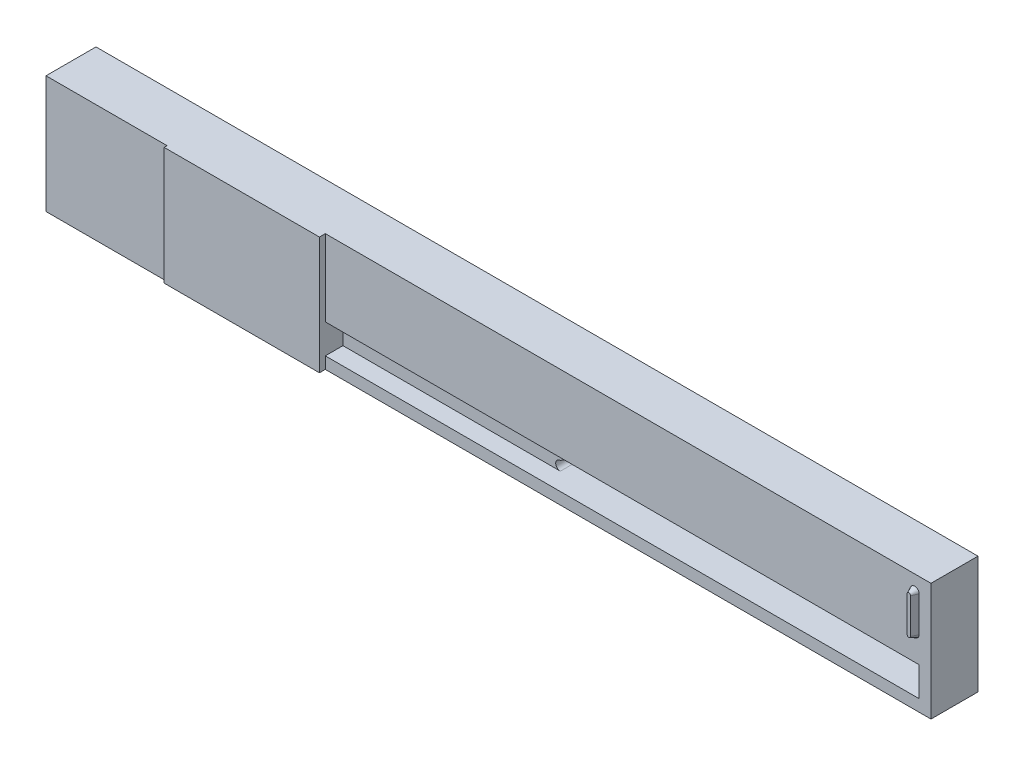
from build123d import *

# Parameters (mm, degrees)
SKETCH1_W               = 130
SKETCH1_H               = 20
BOSS_EXTRUDE1_DEPTH     = 8
SKETCH2_W               = 3
SKETCH2_H               = 13.5
CUT_EXTRUDE1_DEPTH      = 7
SKETCH3_W               = 27
SKETCH3_H               = 20
BOSS_EXTRUDE2_DEPTH     = 1
CUT_EXTRUDE3_DEPTH      = 2
CUT_EXTRUDE4_DEPTH      = 7
SKETCH7_R               = 3.15
CUT_EXTRUDE5_DEPTH      = 3
BOSS_EXTRUDE3_DEPTH     = 1.5
CIRPATTERN1_COUNT       = 8
SKETCH9_R               = 1
CUT_EXTRUDE6_DEPTH      = 1
CUT_EXTRUDE6_DRAFT      = -25
SKETCH10_R              = 0.5
CUT_EXTRUDE7_DEPTH      = 3
SKETCH11_W              = 101
SKETCH11_H              = 5
CUT_EXTRUDE8_DEPTH      = 3
BOSS_EXTRUDE5_DEPTH     = 5
LPATTERN2_COUNT         = 5
LPATTERN2_PITCH         = 1
BOSS_EXTRUDE6_DEPTH     = 5
LPATTERN3_COUNT         = 3
LPATTERN3_PITCH         = 1
BOSS_EXTRUDE7_DEPTH     = 1
BOSS_EXTRUDE7_TAPER     = 25
SKETCH18_W              = 0.569871795
SKETCH18_H              = 4.640384615
SKETCH18_H_2            = 6.512820512
CUT_EXTRUDE10_DEPTH     = 1
SKETCH19_W              = 9
SKETCH19_H              = 20
BOSS_EXTRUDE8_DEPTH     = 20
CUT_EXTRUDE11_START     = -0.5
CUT_EXTRUDE11_OUTLINE_W = 20.583981275
CUT_EXTRUDE11_OUTLINE_H = 20
CUT_EXTRUDE11_DEPTH     = 0.5


# Read off the part's stored shape, not the designer's step: Cut-Extrude11
with BuildPart() as part:
    # Sketch1 → Boss-Extrude1 (new body)
    with BuildSketch(Plane.XY):
        Rectangle(SKETCH1_W, SKETCH1_H)
    extrude(amount=BOSS_EXTRUDE1_DEPTH)

    # Sketch2 → Cut-Extrude1 (cut)
    with BuildSketch(Plane.ZY.offset(65)):
        with Locations((3.1, 0.45)):
            Rectangle(SKETCH2_W, SKETCH2_H)
    extrude(amount=-CUT_EXTRUDE1_DEPTH, mode=Mode.SUBTRACT)

    # Sketch3 → Boss-Extrude2 (add)
    with BuildSketch(Plane.XY.offset(8)):
        with Locations((-51.5, 0)):
            Rectangle(SKETCH3_W, SKETCH3_H)
    extrude(amount=BOSS_EXTRUDE2_DEPTH)

    # Sketch4 → Cut-Extrude3 (cut)
    with BuildSketch(Plane(origin=(0, 0, 0), x_dir=(-1, 0, 0), z_dir=(0, 0, -1))):
        Polygon((-4, -9), (7, -9), (-4, -2), (-64, -2), (-64, -9), align=None)
    extrude(amount=-CUT_EXTRUDE3_DEPTH, mode=Mode.SUBTRACT)

    # Sketch6 → Cut-Extrude4 (cut)
    with BuildSketch(Plane(origin=(0, 0, 2), x_dir=(-1, 0, 0), z_dir=(0, 0, -1))):
        with BuildLine():
            Line((-63, -3), (-4, -3))
            Line((-4, -3), (1.029142106, -6.427272248))
            ThreePointArc((1.029142106, -6.427272248), (1.815505982, -7.213636124), (1.029142106, -8))
            Line((1.029142106, -8), (-4, -8))
            Line((-4, -8), (-63, -8))
            Line((-63, -8), (-63, -3))
        make_face()
    extrude(amount=-CUT_EXTRUDE4_DEPTH, mode=Mode.SUBTRACT)

    # Sketch7 → Cut-Extrude5 (cut)
    with BuildSketch(Plane(origin=(0, 0, 0), x_dir=(-1, 0, 0), z_dir=(0, 0, -1))):
        with Locations((-46, 4)):
            Circle(SKETCH7_R)
    extrude(amount=-CUT_EXTRUDE5_DEPTH, mode=Mode.SUBTRACT)

    # Sketch8 → Boss-Extrude3 (add)
    with BuildSketch(Plane(origin=(0, 0, 3), x_dir=(-1, 0, 0), z_dir=(0, 0, -1))):
        with BuildLine():
            Line((-46, 4), (-46, 6))
            ThreePointArc((-46, 6), (-45, 6.414213562), (-44.585786438, 5.414213562))
            Line((-44.585786438, 5.414213562), (-46, 4))
        make_face()
    boss_extrude3 = extrude(amount=BOSS_EXTRUDE3_DEPTH)

    # CirPattern1: Boss-Extrude3 ×8 about axis
    cirpattern1_axis = Axis((46, 4, 0), (0, 0, 1))
    for i in range(1, CIRPATTERN1_COUNT):
        add(boss_extrude3.rotate(cirpattern1_axis, i * 360 / CIRPATTERN1_COUNT))


with BuildPart() as cut_extrude6_tool:
    # Sketch9 → Cut-Extrude6 (with draft: the straight prism first)
    with BuildSketch(Plane(origin=(0, 0, 1.5), x_dir=(-1, 0, 0), z_dir=(0, 0, -1))):
        with Locations((-46, 4)):
            Circle(SKETCH9_R)
    extrude(amount=-CUT_EXTRUDE6_DEPTH)
    # Cut-Extrude6: the draft: its side faces are tilted about the plane it starts from
    cut_extrude6_sides = [cut_extrude6_tool.faces().sort_by_distance(p)[0] for p in [
        (47, 4, 2),
    ]]
    draft(cut_extrude6_sides, Plane(origin=(0, 0, 1.5), x_dir=(-1, 0, 0), z_dir=(0, 0, -1)), CUT_EXTRUDE6_DRAFT)


with BuildPart() as part_1:
    add(part.part)

    # Cut-Extrude6: cut by cut_extrude6_tool
    add(cut_extrude6_tool.part, mode=Mode.SUBTRACT)

    # Sketch10 → Cut-Extrude7 (cut)
    with BuildSketch(Plane(origin=(0, 0, 0), x_dir=(-1, 0, 0), z_dir=(0, 0, -1))):
        with Locations((-54.346544303, 4)):
            Circle(SKETCH10_R)
    extrude(amount=-CUT_EXTRUDE7_DEPTH, mode=Mode.SUBTRACT)

    # Sketch11 → Cut-Extrude8 (cut)
    with BuildSketch(Plane.XY.offset(8)):
        with Locations((12.5, -5.5)):
            Rectangle(SKETCH11_W, SKETCH11_H)
    extrude(amount=-CUT_EXTRUDE8_DEPTH, mode=Mode.SUBTRACT)

    # Sketch13 → Boss-Extrude5 (add)
    with BuildSketch(Plane.ZY.offset(58)):
        with BuildLine():
            Line((2.394077923, -5.196267403), (2.394077923, -4.196267403))
            Line((2.394077923, -4.196267403), (3.296543728, -4.196267403))
            ThreePointArc((3.296543728, -4.196267403), (3.796543728, -4.696267403), (3.296543728, -5.196267403))
            Line((3.296543728, -5.196267403), (2.394077923, -5.196267403))
        make_face()
    boss_extrude5 = extrude(amount=BOSS_EXTRUDE5_DEPTH)

    # LPattern2: Boss-Extrude5 ×5
    with Locations(*[(0, i * LPATTERN2_PITCH, 0) for i in range(1, LPATTERN2_COUNT)]):
        add(boss_extrude5)

    # Sketch15 → Boss-Extrude6 (add)
    with BuildSketch(Plane.ZY.offset(58)):
        with BuildLine():
            Line((2.394077923, 2.550445293), (2.394077923, 3.550445293))
            Line((2.394077923, 3.550445293), (3.394077923, 3.550445293))
            ThreePointArc((3.394077923, 3.550445293), (3.894077923, 3.050445293), (3.394077923, 2.550445293))
            Line((3.394077923, 2.550445293), (2.394077923, 2.550445293))
        make_face()
    boss_extrude6 = extrude(amount=BOSS_EXTRUDE6_DEPTH)

    # LPattern3: Boss-Extrude6 ×3
    with Locations(*[(0, i * LPATTERN3_PITCH, 0) for i in range(1, LPATTERN3_COUNT)]):
        add(boss_extrude6)

    # Sketch16 → Boss-Extrude7 (add)
    with BuildSketch(Plane.XY.offset(8)):
        with BuildLine():
            Line((63, 1.437655511), (63, 7.437655511))
            ThreePointArc((63, 7.437655511), (62.243555183, 8.194100328), (61.487110367, 7.437655511))
            Line((61.487110367, 7.437655511), (61.487110367, 1.437655511))
            ThreePointArc((61.487110367, 1.437655511), (62.243555183, 0.681210694), (63, 1.437655511))
        make_face()
    extrude(amount=BOSS_EXTRUDE7_DEPTH, taper=BOSS_EXTRUDE7_TAPER)

    # Sketch18 → Cut-Extrude10 (cut)
    # profile 1 of 6: a face of its own
    with BuildSketch(Plane(origin=(0, 0, 0), x_dir=(-1, 0, 0), z_dir=(0, 0, -1))):
        with BuildLine():
            add(Edge.make_bspline(
                [(33.830181075, 3.951769435), (33.865543891, 3.950129044), (33.934791076, 3.946916844), (34.034927433, 3.919409593), (34.126108012, 3.87278302), (34.206984756, 3.810227028), (34.276384608, 3.736658752), (34.324972468, 3.650913852), (34.356200672, 3.558278893), (34.359971766, 3.493662946), (34.361891812, 3.460763826)],
                knots=[0, 0, 0, 0, 1.055194115, 2.066272739, 3.074728998, 4.095836921, 5.109056067, 6.073838105, 7.019297344, 8, 8, 8, 8], degree=3))
            add(Edge.make_bspline(
                [(34.361891812, 3.460763826), (34.359928465, 3.428718727), (34.35604716, 3.365369358), (34.324996589, 3.274340344), (34.275970529, 3.189786858), (34.207029258, 3.116361427), (34.12609622, 3.053840016), (34.034930566, 3.007204276), (33.934790252, 2.979699455), (33.865543612, 2.97648692), (33.830181075, 2.974846358)],
                knots=[0, 0, 0, 0, 0.96129708, 1.900370562, 2.859976407, 3.87933698, 4.906634145, 5.921202961, 6.938410037, 8, 8, 8, 8], degree=3))
            add(Edge.make_bspline(
                [(33.830181075, 2.974846358), (33.795222919, 2.976424279), (33.727181435, 2.979495496), (33.628544449, 3.007743957), (33.538141333, 3.053855975), (33.457106855, 3.115952054), (33.389560648, 3.190237796), (33.340396543, 3.274288743), (33.309417684, 3.365382495), (33.305526715, 3.42872314), (33.303558479, 3.460763826)],
                knots=[0, 0, 0, 0, 1.054934014, 2.053291228, 3.073705704, 4.106921865, 5.123545215, 6.088680038, 7.033164197, 8, 8, 8, 8], degree=3))
            add(Edge.make_bspline(
                [(33.303558479, 3.460763826), (33.305483593, 3.493658367), (33.309264639, 3.558265322), (33.340419764, 3.65096631), (33.38915113, 3.736204178), (33.457151581, 3.810636156), (33.53812943, 3.872767159), (33.628547525, 3.918869939), (33.727180622, 3.947120798), (33.795222643, 3.950191684), (33.830181075, 3.951769435)],
                knots=[0, 0, 0, 0, 0.98631895, 1.937192651, 2.907499808, 3.917963147, 4.944918757, 5.95915025, 6.951458133, 8, 8, 8, 8], degree=3))
        make_face()
    # profile 2 of 6: a face of its own
    with BuildSketch(Plane(origin=(0, 0, 0), x_dir=(-1, 0, 0), z_dir=(0, 0, -1))):
        with Locations((33.832725146, -0.322269026)):
            Rectangle(SKETCH18_W, SKETCH18_H)
    # profile 3 of 6: a face of its own
    with BuildSketch(Plane(origin=(0, 0, 0), x_dir=(-1, 0, 0), z_dir=(0, 0, -1))):
        with BuildLine():
            Line((35.501635402, 1.997923281), (36.071507197, 1.997923281))
            Line((36.071507197, 1.997923281), (36.071507197, 1.160924082))
            add(Edge.make_bspline(
                [(36.071507197, 1.160924082), (36.132354049, 1.236838737), (36.250429489, 1.384153772), (36.447069637, 1.577775386), (36.654884999, 1.737333151), (36.872602919, 1.864521463), (37.100518952, 1.960400342), (37.337243813, 2.029644245), (37.58419478, 2.071163863), (37.752133115, 2.076588995), (37.837092133, 2.079333537)],
                knots=[0, 0, 0, 0, 1.12780773, 2.188550248, 3.19190651, 4.159438251, 5.104880172, 6.052711206, 7.014878035, 8, 8, 8, 8], degree=3))
            add(Edge.make_bspline(
                [(37.837092133, 2.079333537), (37.922963426, 2.076167254), (38.091034261, 2.069970074), (38.335741601, 2.020954078), (38.564293329, 1.9372334), (38.775874523, 1.822548644), (38.966605325, 1.679934042), (39.134108984, 1.513785781), (39.272653732, 1.32267603), (39.365540377, 1.145378304), (39.426728338, 0.988100063), (39.465249864, 0.853395245), (39.497963216, 0.703320885), (39.526323673, 0.538330488), (39.545513576, 0.357268057), (39.560648877, 0.160875815), (39.571495936, -0.050782621), (39.571926298, -0.197171217), (39.572148223, -0.272659652)],
                knots=[0, 0, 0, 0, 1.235846778, 2.418850247, 3.575807741, 4.728682307, 5.871620074, 6.994088408, 8.11269785, 9.256955736, 9.865816715, 10.540099792, 11.271859618, 12.076849838, 12.949306005, 13.892391288, 14.913166135, 16, 16, 16, 16], degree=3))
            Line((39.572148223, -0.272659652), (39.572148223, -2.642461334))
            Line((39.572148223, -2.642461334), (39.002276428, -2.642461334))
            Line((39.002276428, -2.642461334), (39.002276428, -0.459648834))
            add(Edge.make_bspline(
                [(39.002276428, -0.459648834), (39.001925893, -0.39647097), (39.00125538, -0.275622468), (38.999140564, -0.102595811), (38.994042772, 0.054315552), (38.986879404, 0.19473649), (38.976394592, 0.318532165), (38.965467818, 0.42595471), (38.952105646, 0.516867737), (38.940198646, 0.571595815), (38.934858559, 0.596140428)],
                knots=[0, 0, 0, 0, 1.430800155, 2.736877192, 3.918605307, 4.986035426, 5.920637409, 6.731861385, 7.431261377, 8, 8, 8, 8], degree=3))
            add(Edge.make_bspline(
                [(38.934858559, 0.596140428), (38.915580809, 0.668187864), (38.878477105, 0.806856886), (38.786794021, 0.994951783), (38.671016865, 1.154968495), (38.529687909, 1.28591769), (38.364172301, 1.387827637), (38.174929342, 1.458537526), (37.963785236, 1.502763043), (37.815277999, 1.507166554), (37.737873383, 1.509461743)],
                knots=[0, 0, 0, 0, 1.084156227, 2.086665306, 3.027808233, 3.945421172, 4.874247719, 5.839848303, 6.874090471, 8, 8, 8, 8], degree=3))
            add(Edge.make_bspline(
                [(37.737873383, 1.509461743), (37.692030586, 1.508598134), (37.601308874, 1.506889075), (37.466779639, 1.48974172), (37.336288639, 1.461695665), (37.20852626, 1.423833994), (37.086047834, 1.371832449), (36.964918335, 1.312814877), (36.84969892, 1.239248835), (36.737932756, 1.157260136), (36.633950948, 1.066402146), (36.537198106, 0.970527106), (36.450950555, 0.868427082), (36.372811672, 0.761747177), (36.30535968, 0.649022271), (36.246480506, 0.531339887), (36.196522888, 0.408545131), (36.171698575, 0.323318948), (36.15927763, 0.280675685)],
                knots=[0, 0, 0, 0, 1.023777757, 2.026029729, 3.023749952, 4.003683103, 4.997618607, 5.993177895, 7.010360494, 8.046726602, 9.087585522, 10.09234134, 11.086953743, 12.070360549, 13.043493632, 14.017870808, 15.008233677, 16, 16, 16, 16], degree=3))
            add(Edge.make_bspline(
                [(36.15927763, 0.280675685), (36.152129982, 0.249369816), (36.136569926, 0.181218579), (36.119763871, 0.069377989), (36.104510127, -0.05999868), (36.091743073, -0.206760455), (36.083931818, -0.371421171), (36.075414841, -0.55327762), (36.072314116, -0.753054949), (36.071783702, -0.892141163), (36.071507197, -0.964646831)],
                knots=[0, 0, 0, 0, 0.615963638, 1.340920617, 2.168419149, 3.115676021, 4.16674242, 5.331190069, 6.6087489, 8, 8, 8, 8], degree=3))
            Line((36.071507197, -0.964646831), (36.071507197, -2.642461334))
            Line((36.071507197, -2.642461334), (35.501635402, -2.642461334))
            Line((35.501635402, -2.642461334), (35.501635402, 1.997923281))
        make_face()
    # profile 4 of 6: a face of its own
    with BuildSketch(Plane(origin=(0, 0, 0), x_dir=(-1, 0, 0), z_dir=(0, 0, -1))):
        Polygon((41.44458412, 3.870359178), (42.014455915, 3.870359178), (42.014455915, 1.997923281), (42.828558479, 1.997923281), (42.828558479, 1.428051486), (42.014455915, 1.428051486), (42.014455915, -2.642461334), (41.44458412, -2.642461334), (41.44458412, 1.428051486), (40.630481556, 1.428051486), (40.630481556, 1.997923281), (41.44458412, 1.997923281), align=None)
    # profile 5 of 6: a face of its own
    with BuildSketch(Plane(origin=(0, 0, 0), x_dir=(-1, 0, 0), z_dir=(0, 0, -1))):
        with BuildLine():
            Line((47.613955114, -1.177076719), (48.120225146, -1.442932088))
            add(Edge.make_bspline(
                [(48.120225146, -1.442932088), (48.079881609, -1.51449356), (48.001389062, -1.653723847), (47.866404848, -1.845007365), (47.724904945, -2.017088221), (47.570502031, -2.165369165), (47.407815614, -2.294639535), (47.235943512, -2.40773816), (47.053990942, -2.504110332), (46.861949299, -2.585304204), (46.658205827, -2.647732858), (46.44226679, -2.691827659), (46.213718506, -2.71908416), (46.057061865, -2.722250344), (45.976845739, -2.723871591)],
                knots=[0, 0, 0, 0, 1.120438281, 2.179929193, 3.190490725, 4.156257408, 5.095198341, 6.022838206, 6.959905092, 7.901321166, 8.864066838, 9.862729781, 10.905609505, 12, 12, 12, 12], degree=3))
            add(Edge.make_bspline(
                [(45.976845739, -2.723871591), (45.887688151, -2.721790287), (45.713767526, -2.717730266), (45.460602556, -2.682728224), (45.222242754, -2.625628373), (44.998701521, -2.545862319), (44.790526292, -2.441672745), (44.597303312, -2.314746257), (44.418016458, -2.165734881), (44.258315393, -1.993347904), (44.114544348, -1.808867782), (43.987678932, -1.616633534), (43.88162045, -1.417128827), (43.795346429, -1.211623733), (43.725669031, -1.001413527), (43.677106583, -0.784585578), (43.649112611, -0.561726733), (43.644822832, -0.410964424), (43.642661043, -0.334989379)],
                knots=[0, 0, 0, 0, 1.145258523, 2.234067595, 3.276747158, 4.290159414, 5.277019952, 6.260822364, 7.254936242, 8.264827045, 9.274100331, 10.257902744, 11.220704747, 12.172965371, 13.118907548, 14.062713208, 15.023725156, 16, 16, 16, 16], degree=3))
            add(Edge.make_bspline(
                [(43.642661043, -0.334989379), (43.644582628, -0.26369733), (43.648390956, -0.122405902), (43.672395384, 0.086718728), (43.714937288, 0.289970349), (43.773314332, 0.487517848), (43.848700165, 0.679030462), (43.940924334, 0.864624749), (44.050130505, 1.044103217), (44.134445213, 1.157320331), (44.176915851, 1.214349563)],
                knots=[0, 0, 0, 0, 1.024358464, 2.0301432, 3.019427413, 4.004406732, 4.986367066, 5.972626655, 6.978780325, 8, 8, 8, 8], degree=3))
            add(Edge.make_bspline(
                [(44.176915851, 1.214349563), (44.234442647, 1.283054513), (44.347673936, 1.418288015), (44.539183323, 1.59597612), (44.746556537, 1.744826969), (44.967194772, 1.868211345), (45.203662375, 1.961962104), (45.452780661, 2.031825861), (45.717386224, 2.070974538), (45.898279982, 2.076504179), (45.990838127, 2.079333537)],
                knots=[0, 0, 0, 0, 1.030682036, 2.02871468, 2.997146059, 3.962720338, 4.930598197, 5.918074684, 6.934738563, 8, 8, 8, 8], degree=3))
            add(Edge.make_bspline(
                [(45.990838127, 2.079333537), (46.085993068, 2.076876906), (46.272665371, 2.072057555), (46.544866505, 2.02737835), (46.802423805, 1.956525858), (47.045234205, 1.856461124), (47.273322324, 1.727357366), (47.485205586, 1.567442882), (47.684507616, 1.381627209), (47.800456037, 1.238728243), (47.859457918, 1.166012223)],
                knots=[0, 0, 0, 0, 1.056321875, 2.072262726, 3.055038591, 4.01806755, 4.982017516, 5.957941055, 6.960871419, 8, 8, 8, 8], degree=3))
            add(Edge.make_bspline(
                [(47.859457918, 1.166012223), (47.899602506, 1.111214297), (47.979624468, 1.001983196), (48.079858492, 0.823872668), (48.166866909, 0.637526304), (48.236413853, 0.439931908), (48.292728376, 0.23343067), (48.333471462, 0.016546339), (48.357364912, -0.210656501), (48.362061549, -0.365463251), (48.364455915, -0.444384411)],
                knots=[0, 0, 0, 0, 0.94817472, 1.890038105, 2.849395472, 3.817997239, 4.812318967, 5.836947057, 6.897266129, 8, 8, 8, 8], degree=3))
            Line((48.364455915, -0.444384411), (44.212532838, -0.444384411))
            add(Edge.make_bspline(
                [(44.212532838, -0.444384411), (44.215326124, -0.505526682), (44.220819008, -0.625760492), (44.246427911, -0.801693198), (44.286793543, -0.969284833), (44.343524557, -1.127278352), (44.412225833, -1.277737298), (44.496382777, -1.419545565), (44.596784539, -1.552057238), (44.708772593, -1.676457616), (44.833426895, -1.787239283), (44.964568451, -1.88639322), (45.104075347, -1.96949766), (45.250847584, -2.036952603), (45.404647823, -2.089759776), (45.56552452, -2.125805679), (45.733161102, -2.149948573), (45.84743522, -2.152633109), (45.905611764, -2.153999796)],
                knots=[0, 0, 0, 0, 1.094153842, 2.151609401, 3.174256925, 4.172055639, 5.149267565, 6.128595816, 7.11444997, 8.118368179, 9.117203808, 10.09244225, 11.054858984, 12.015122123, 12.976791628, 13.957293641, 14.960065497, 16, 16, 16, 16], degree=3))
            add(Edge.make_bspline(
                [(45.905611764, -2.153999796), (45.962491704, -2.152896607), (46.075352414, -2.15070767), (46.243429398, -2.129422631), (46.408782541, -2.095005131), (46.570727468, -2.048033292), (46.725977431, -1.990743861), (46.8697515, -1.92161439), (47.001977034, -1.845142707), (47.125560674, -1.757676582), (47.245432333, -1.650618871), (47.36434513, -1.517022635), (47.491847058, -1.359020977), (47.571656748, -1.240102412), (47.613955114, -1.177076719)],
                knots=[0, 0, 0, 0, 0.99110716, 1.966546729, 2.947904876, 3.932708344, 4.903319531, 5.828989031, 6.710028674, 7.56322171, 8.463672341, 9.504779593, 10.677557249, 12, 12, 12, 12], degree=3))
        make_face()
        with BuildLine():
            add(Edge.make_bspline(
                [(47.79458412, 0.125487384), (47.773725958, 0.20107574), (47.733580711, 0.346558995), (47.649694736, 0.548018896), (47.555222084, 0.727066945), (47.443422657, 0.882332851), (47.31675154, 1.020224938), (47.170438137, 1.140727229), (47.006361588, 1.248527461), (46.825370004, 1.339518425), (46.633705622, 1.416970025), (46.433034388, 1.468904164), (46.228278116, 1.504481476), (46.089785911, 1.507794559), (46.020094937, 1.509461743)],
                knots=[0, 0, 0, 0, 1.154881502, 2.222775134, 3.210006277, 4.132804581, 5.035138423, 5.962687519, 6.919655026, 7.923214229, 8.944639381, 9.960483929, 10.97369054, 12, 12, 12, 12], degree=3))
            add(Edge.make_bspline(
                [(46.020094937, 1.509461743), (45.963218099, 1.508351996), (45.850784547, 1.506158259), (45.685138323, 1.485348167), (45.526062298, 1.450949592), (45.372382705, 1.403841742), (45.226113415, 1.341051849), (45.084245764, 1.26742228), (44.950387045, 1.177539693), (44.866673552, 1.109034342), (44.824381796, 1.074425685)],
                knots=[0, 0, 0, 0, 1.04873581, 2.073130211, 3.073294108, 4.04793562, 5.032784715, 6.005352987, 6.992311501, 8, 8, 8, 8], degree=3))
            add(Edge.make_bspline(
                [(44.824381796, 1.074425685), (44.794095413, 1.047040284), (44.732803156, 0.991618906), (44.650905352, 0.896134488), (44.572491066, 0.79317094), (44.501128582, 0.678789071), (44.435673532, 0.554291372), (44.374423288, 0.420727948), (44.319293654, 0.277085269), (44.288276426, 0.1769867), (44.272318495, 0.125487384)],
                knots=[0, 0, 0, 0, 0.879870761, 1.780643979, 2.707998968, 3.669668524, 4.684282772, 5.740141944, 6.837334558, 8, 8, 8, 8], degree=3))
            Line((44.272318495, 0.125487384), (47.79458412, 0.125487384))
        make_face(mode=Mode.SUBTRACT)
    # profile 6 of 6: a face of its own
    with BuildSketch(Plane(origin=(0, 0, 0), x_dir=(-1, 0, 0), z_dir=(0, 0, -1))):
        with Locations((49.707725146, 0.613948922)):
            Rectangle(SKETCH18_W, SKETCH18_H_2)
    extrude(amount=-CUT_EXTRUDE10_DEPTH, mode=Mode.SUBTRACT)

    # Sketch19 → Boss-Extrude8 (add)
    with BuildSketch(Plane.ZY.offset(65)):
        with Locations((4.5, 0)):
            Rectangle(SKETCH19_W, SKETCH19_H)
    extrude(amount=BOSS_EXTRUDE8_DEPTH)

    # Cut-Extrude11 outline → Cut-Extrude11 (cut)
    with BuildSketch(Plane.XY.offset(9).offset(CUT_EXTRUDE11_START)):
        with Locations((-74.708009363, 0)):
            Rectangle(CUT_EXTRUDE11_OUTLINE_W, CUT_EXTRUDE11_OUTLINE_H)
    extrude(amount=CUT_EXTRUDE11_DEPTH, mode=Mode.SUBTRACT)


solid = part_1.part
